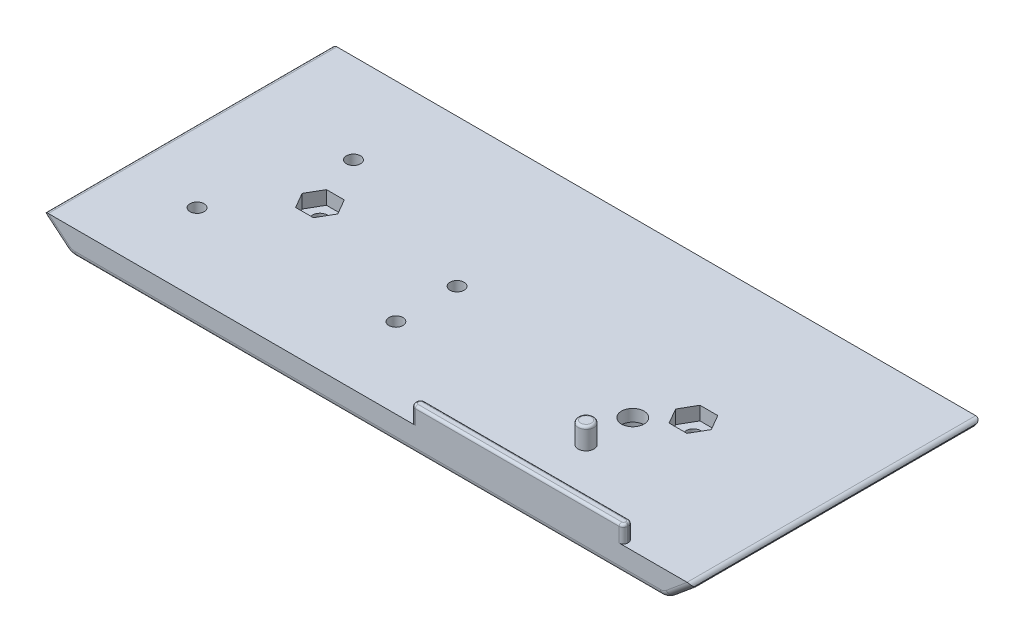
from build123d import *

# Parameters (mm, degrees)
SKETCH1_W            = 196.85
SKETCH1_H            = 86.36
BOSS_EXTRUDE1_DEPTH  = 7.62
SKETCH7_W            = 63.5
SKETCH7_H            = 2.794
BOSS_EXTRUDE3_DEPTH  = 5.08
FILLET1_R            = 1.27
SKETCH6_R            = 2.3495
BOSS_EXTRUDE4_DEPTH  = 6.35
CUT_EXTRUDE3_DEPTH   = 4.064
SKETCH15_R           = 2.2479
CUT_EXTRUDE4_DEPTH   = 108.983537731
SKETCH17_R           = 3.3782
CUT_EXTRUDE5_DEPTH   = 108.74997645
SKETCH19_R           = 6.858
CUT_EXTRUDE6_DEPTH   = 4.064
SKETCH20_W           = 119.676272879
SKETCH20_H           = 31.665859335
CUT_EXTRUDE7_DEPTH   = 3.175
M3_CLEARANCE_HOLE1_D = 4.2
SKETCH26_R           = 3.05
CUT_EXTRUDE8_DEPTH   = 4
CHAMFER1_SIZE        = 7.62
CHAMFER1_SIZE2       = 6.35
FILLET5_R            = 1.27
FILLET6_R            = 4.318
FILLET7_R            = 1.778
FILLET8_R            = 0.762


with BuildPart() as part:
    # Sketch1 → Boss-Extrude1 (new body)
    with BuildSketch(Plane(origin=(0, 0, 0), x_dir=(1, 0, 0), z_dir=(0, 1, 0))):
        Rectangle(SKETCH1_W, SKETCH1_H)
    extrude(amount=BOSS_EXTRUDE1_DEPTH)

    # Sketch7 → Boss-Extrude3 (add)
    with BuildSketch(Plane(origin=(0, 7.62, 0), x_dir=(1, 0, 0), z_dir=(0, 1, 0))):
        with Locations((46.355, -41.783)):
            Rectangle(SKETCH7_W, SKETCH7_H)
    extrude(amount=BOSS_EXTRUDE3_DEPTH)

    # Fillet1
    fillet1_edges = [part.edges().sort_by_distance(p)[0] for p in [
        (14.605, 10.16, 40.386),
        (14.605, 10.16, 43.18),
        (78.105, 10.16, 43.18),
        (78.105, 10.16, 40.386),
    ]]
    fillet(fillet1_edges, radius=FILLET1_R)

    # Sketch6 → Boss-Extrude4 (add)
    with BuildSketch(Plane(origin=(0, 7.62, 0), x_dir=(1, 0, 0), z_dir=(0, 1, 0))):
        with Locations(Location((46.355, -22.606, 0), (0, 0, 270))):
            Circle(SKETCH6_R)
    extrude(amount=BOSS_EXTRUDE4_DEPTH)

    # Sketch14 → Cut-Extrude3 (cut)
    with BuildSketch(Plane(origin=(0, 7.62, 0), x_dir=(1, 0, 0), z_dir=(0, 1, 0))):
        Polygon((-53.213, 4.619379504), (-58.547, 4.619379504), (-61.214, 0), (-58.547, -4.619379504), (-53.213, -4.619379504), (-50.546, 0), align=None)
        Polygon((61.214, 0), (58.547, 4.619379504), (53.213, 4.619379504), (50.546, 0), (53.213, -4.619379504), (58.547, -4.619379504), align=None)
    extrude(amount=-CUT_EXTRUDE3_DEPTH, mode=Mode.SUBTRACT)

    # Sketch15 → Cut-Extrude4 (cut, through all)
    with BuildSketch(Plane(origin=(0, 3.556, 0), x_dir=(1, 0, 0), z_dir=(0, 1, 0))):
        with Locations(Location((-55.88, 0, 0), (0, 0, 270))):
            Circle(SKETCH15_R)
        with Locations(Location((55.88, 0, 0), (0, 0, 270))):
            Circle(SKETCH15_R)
    extrude(amount=-CUT_EXTRUDE4_DEPTH, mode=Mode.SUBTRACT)

    # Sketch17 → Cut-Extrude5 (cut, through all)
    with BuildSketch(Plane(origin=(0, 7.62, 0), x_dir=(1, 0, 0), z_dir=(0, 1, 0))):
        with Locations(Location((46.355, -8.636, 0), (0, 0, 270))):
            Circle(SKETCH17_R)
    extrude(amount=-CUT_EXTRUDE5_DEPTH, mode=Mode.SUBTRACT)

    # Sketch19 → Cut-Extrude6 (cut)
    with BuildSketch(Plane.XZ):
        with Locations(Location((46.355, 8.636, 0), (0, 0, 270))):
            Circle(SKETCH19_R)
    extrude(amount=-CUT_EXTRUDE6_DEPTH, mode=Mode.SUBTRACT)

    # Sketch20 → Cut-Extrude7 (cut)
    with BuildSketch(Plane.ZY.offset(98.425)):
        with Locations((11.670595095, 4.377895417)):
            Rectangle(SKETCH20_W, SKETCH20_H)
    extrude(amount=-CUT_EXTRUDE7_DEPTH, mode=Mode.SUBTRACT)

    # M3 Clearance Hole1 (through all)
    with Locations(Plane(origin=(0, 0, 0), x_dir=(-1, 0, 0), z_dir=(0, -1, 0))):
        with Locations((13.97, -19.177), (13.97, -0.889), (73.2282, -19.431), (62.23, 16.383324254)):
            Hole(M3_CLEARANCE_HOLE1_D / 2)

    # Sketch26 → Cut-Extrude8 (cut)
    with BuildSketch(Plane.XZ):
        with Locations(Location((-73.2282, 19.431, 0), (0, 0, 270))):
            Circle(SKETCH26_R)
        with Locations(Location((-62.23, -16.383324254, 0), (0, 0, 270))):
            Circle(SKETCH26_R)
        with Locations(Location((-13.97, 0.889, 0), (0, 0, 270))):
            Circle(SKETCH26_R)
        with Locations(Location((-13.97, 19.177, 0), (0, 0, 270))):
            Circle(SKETCH26_R)
    extrude(amount=-CUT_EXTRUDE8_DEPTH, mode=Mode.SUBTRACT)

    # Chamfer1
    chamfer1_edges = [part.edges().sort_by_distance(p)[0] for p in [
        (-95.25, 0, 0),
        (98.425, 0, 0),
    ]]
    chamfer1_side = [part.faces().sort_by_distance(p)[0] for p in [
        (1.4899049, 0, -0.118781761),
    ]]
    chamfer(chamfer1_edges, length=CHAMFER1_SIZE, length2=CHAMFER1_SIZE2, reference=chamfer1_side[0])

    # Fillet5
    # the kernel refuses this fillet: 1.27 mm, written as the material it takes off along each edge
    with BuildSketch(Plane(origin=(-95.25, 7.62, -46.355), x_dir=(1, 0, 0), z_dir=(0, 0, 1)), Plane(origin=(98.425, 7.62, -46.355), x_dir=(0, -1, 0), z_dir=(0, 0, 1))) as fillet5_piece_1:
        with BuildLine():
            CenterArc((FILLET5_R, -FILLET5_R), FILLET5_R, 90, 90)
            Line((0, -FILLET5_R), (0, 0))
            Line((0, 0), (FILLET5_R, 0))
        make_face()
    extrude(amount=92.71, mode=Mode.SUBTRACT)
    with BuildSketch(Plane(origin=(-95.25, 6.35, -44.667090454), x_dir=(0.7682212795973746, -0.6401843996644814, 0), z_dir=(0, 0, 1)), Plane(origin=(98.425, 6.35, -44.667090454), x_dir=(0, 1, 0), z_dir=(0, 0, 1))) as fillet5_piece_2:
        with BuildLine():
            CenterArc((FILLET5_R * 0.468374945984, FILLET5_R), FILLET5_R, 219.805571092, 50.194428908)
            Line((-FILLET5_R * 0.299846333613, FILLET5_R * 0.359815600336), (0, 0))
            Line((0, 0), (FILLET5_R * 0.468374945984, 0))
        make_face()
    extrude(amount=89.334180907, mode=Mode.SUBTRACT)

    # Fillet6
    fillet6_edges = [part.edges().sort_by_distance(p)[0] for p in [
        (90.805, 0, 0),
        (-87.63, 0, 0),
    ]]
    fillet(fillet6_edges, radius=FILLET6_R)

    # Fillet7
    # the kernel refuses this fillet: 1.778 mm, written as the material it takes off along each edge
    with BuildSketch(Plane(origin=(-88.830984618, 1.000820515, 43.18), x_dir=(0.6401843996644796, 0.768221279597376, 0), z_dir=(-0.7682212795973761, 0.6401843996644797, 0)), Plane(origin=(-88.830984618, 1.000820515, -43.18), x_dir=(0, 0, 1), z_dir=(-0.7682212795973761, 0.6401843996644797, 0))) as fillet7_piece_1:
        with BuildLine():
            CenterArc((FILLET7_R, FILLET7_R), FILLET7_R, 180, 90)
            Line((0, FILLET7_R), (0, 0))
            Line((0, 0), (FILLET7_R, 0))
        make_face()
    extrude(amount=12.205849287, mode=Mode.SUBTRACT)
    with BuildSketch(Plane(origin=(-86.06666838, 4.318, 43.18), x_dir=(0, -1, 0), z_dir=(1, 0, 0))) as fillet7_piece_2:
        with BuildLine():
            CenterArc((4.318 - FILLET7_R, FILLET7_R), FILLET7_R, 270, 90)
            Line((4.318, FILLET7_R), (4.318, 0))
            Line((4.318, 0), (4.318 - FILLET7_R, 0))
        make_face()
    revolve(axis=Axis((-86.06666838, 4.318, 43.18), (0, 0, -1)), revolution_arc=39.805571092, mode=Mode.SUBTRACT)
    with BuildSketch(Plane(origin=(92.005984618, 1.000820515, 43.18), x_dir=(-0.6401843996644796, 0.768221279597376, 0), z_dir=(0.7682212795973761, 0.6401843996644797, 0)), Plane(origin=(92.005984618, 1.000820515, -43.18), x_dir=(0, 0, 1), z_dir=(0.7682212795973761, 0.6401843996644797, 0))) as fillet7_piece_3:
        with BuildLine():
            CenterArc((FILLET7_R, -FILLET7_R), FILLET7_R, 90, 90)
            Line((0, -FILLET7_R), (0, 0))
            Line((0, 0), (FILLET7_R, 0))
        make_face()
    extrude(amount=12.205849287, mode=Mode.SUBTRACT)
    with BuildSketch(Plane(origin=(89.24166838, 4.318, 43.18), x_dir=(0, -1, 0), z_dir=(-1, 0, 0))) as fillet7_piece_4:
        with BuildLine():
            CenterArc((4.318 - FILLET7_R, -FILLET7_R), FILLET7_R, 0, 90)
            Line((4.318, -FILLET7_R), (4.318, 0))
            Line((4.318, 0), (4.318 - FILLET7_R, 0))
        make_face()
    revolve(axis=Axis((89.24166838, 4.318, 43.18), (0, 0, 1)), revolution_arc=39.805571092, mode=Mode.SUBTRACT)
    with BuildSketch(Plane(origin=(89.24166838, 0, 43.18), x_dir=(0, 1, 0), z_dir=(-1, 0, 0))) as fillet7_piece_5:
        with BuildLine():
            CenterArc((FILLET7_R, FILLET7_R), FILLET7_R, 180, 90)
            Line((0, FILLET7_R), (0, 0))
            Line((0, 0), (FILLET7_R, 0))
        make_face()
    extrude(amount=175.30833676, mode=Mode.SUBTRACT)
    with BuildSketch(Plane(origin=(89.24166838, 4.318, -43.18), x_dir=(0, -1, 0), z_dir=(-1, 0, 0))) as fillet7_piece_6:
        with BuildLine():
            CenterArc((4.318 - FILLET7_R, FILLET7_R), FILLET7_R, 270, 90)
            Line((4.318 - FILLET7_R, 0), (4.318, 0))
            Line((4.318, 0), (4.318, FILLET7_R))
        make_face()
    revolve(axis=Axis((89.24166838, 4.318, -43.18), (0, 0, 1)), revolution_arc=39.805571092, mode=Mode.SUBTRACT)
    with BuildSketch(Plane(origin=(-86.06666838, 4.318, -43.18), x_dir=(0, -1, 0), z_dir=(1, 0, 0))) as fillet7_piece_7:
        with BuildLine():
            CenterArc((4.318 - FILLET7_R, -FILLET7_R), FILLET7_R, 0, 90)
            Line((4.318 - FILLET7_R, 0), (4.318, 0))
            Line((4.318, 0), (4.318, -FILLET7_R))
        make_face()
    revolve(axis=Axis((-86.06666838, 4.318, -43.18), (0, 0, -1)), revolution_arc=39.805571092, mode=Mode.SUBTRACT)
    with BuildSketch(Plane(origin=(-86.06666838, 0, -43.18), x_dir=(0, 0, 1), z_dir=(1, 0, 0))) as fillet7_piece_8:
        with BuildLine():
            CenterArc((FILLET7_R, -FILLET7_R), FILLET7_R, 90, 90)
            Line((0, -FILLET7_R), (0, 0))
            Line((0, 0), (FILLET7_R, 0))
        make_face()
    extrude(amount=175.30833676, mode=Mode.SUBTRACT)

    # Fillet8
    fillet8_edges = [part.edges().sort_by_distance(p)[0] for p in [
        (14.605, 12.7, 41.783),
        (46.355, 12.7, 40.386),
        (46.355, 12.7, 43.18),
        (78.105, 12.7, 41.783),
        (77.733025612, 12.7, 42.808025612),
        (77.733025612, 12.7, 40.757974388),
        (14.976974388, 12.7, 42.808025612),
        (14.976974388, 12.7, 40.757974388),
        (46.355, 13.97, 20.2565),
    ]]
    fillet(fillet8_edges, radius=FILLET8_R)


solid = part.part
